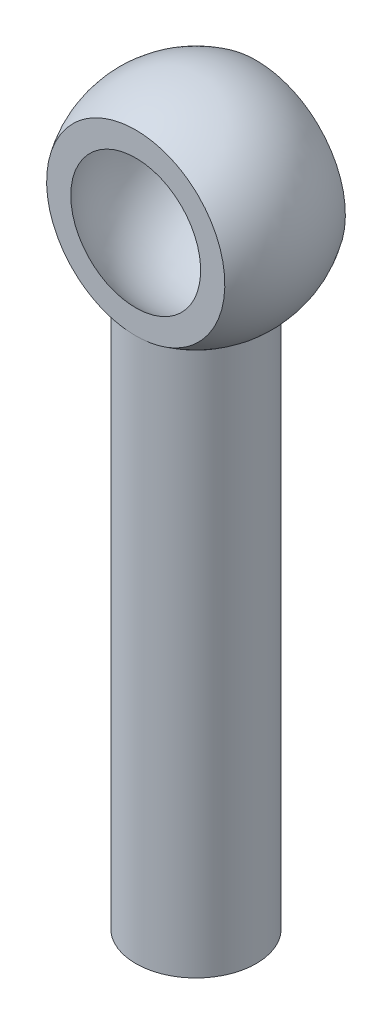
from build123d import *

# Parameters (mm, degrees)
SKETCH1_R               = 4.7625
BOSS_EXTRUDE1_DEPTH     = 50
CUT_EXTRUDE2_DEPTH      = 60.722273902
CUT_EXTRUDE2_DEPTH_BACK = 60.722273902
SKETCH4_W               = 5
SKETCH4_H               = 14.540496698


with BuildPart() as part:
    # Sketch1 → Boss-Extrude1 (new body)
    with BuildSketch(Plane(origin=(0, 0, 0), x_dir=(1, 0, 0), z_dir=(0, 1, 0))):
        Circle(SKETCH1_R)
    extrude(amount=BOSS_EXTRUDE1_DEPTH)

    # Sketch2 → Revolve4 (revolve)
    with BuildSketch(Plane.XY):
        with BuildLine():
            Line((0, 58.5), (0, 41.5))
            ThreePointArc((0, 41.5), (-8.5, 50), (0, 58.5))
        make_face()
    revolve(axis=Axis((0, 58.5, 0), (0, -1, 0)))

    # Sketch4 → Cut-Extrude2 (cut, two sides: drawn at the far end of the back side and taken through both)
    with BuildSketch(Plane(origin=(0, 0, 0), x_dir=(0, 0, -1), z_dir=(1, 0, 0)).offset(-CUT_EXTRUDE2_DEPTH_BACK)):
        with Locations((-7.2625, 50.229751651)):
            Rectangle(SKETCH4_W, SKETCH4_H)
        with Locations((7.26, 50.229751651)):
            Rectangle(SKETCH4_W, SKETCH4_H)
    extrude(amount=CUT_EXTRUDE2_DEPTH + CUT_EXTRUDE2_DEPTH_BACK, mode=Mode.SUBTRACT)

    # Sketch5 → Cut-Revolve1 (revolve, cut)
    with BuildSketch(Plane.XY):
        with BuildLine():
            Line((0, 57), (0, 43))
            ThreePointArc((0, 43), (-7, 50), (0, 57))
        make_face()
    revolve(axis=Axis((0, 57, 0), (0, -1, 0)), mode=Mode.SUBTRACT)


solid = part.part
